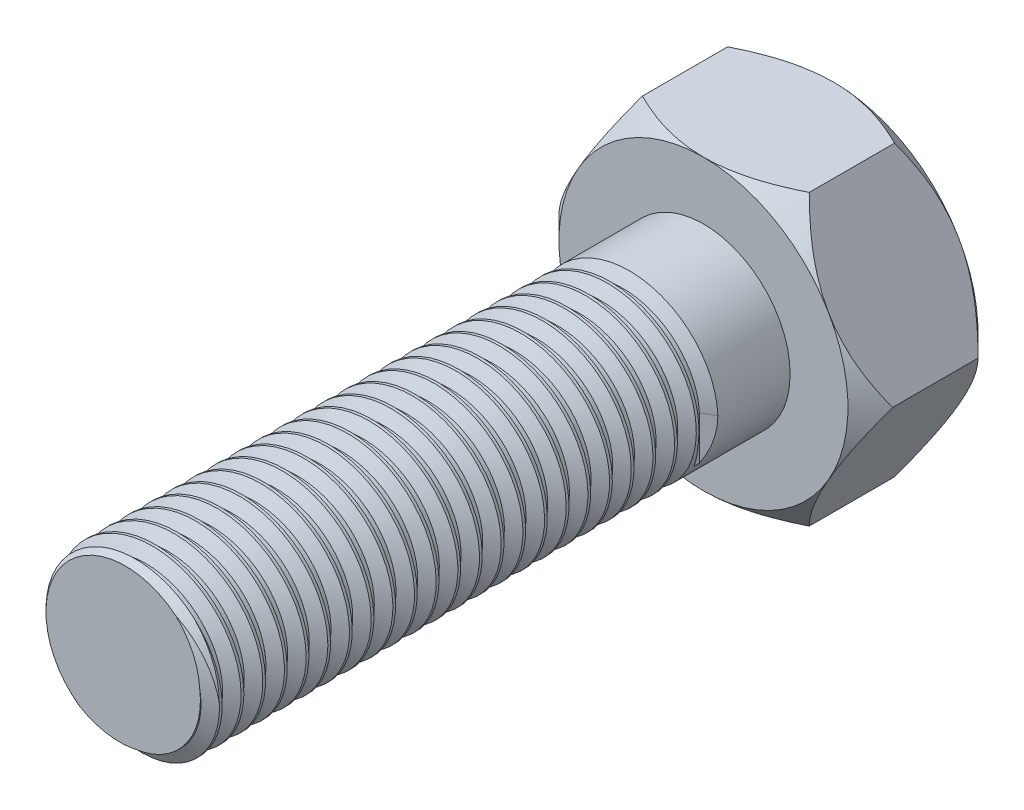
from build123d import *

# Parameters (mm, degrees)
BOSS_EXTRUDE1_DEPTH     = 4.5
SKETCH3_OUTSIDE_W       = 68.922
SKETCH3_OUTSIDE_H       = 65.828
SKETCH3_OUTSIDE_R       = 10
CUT_EXTRUDE1_DEPTH      = 18.729448196
CUT_EXTRUDE1_DRAFT      = -45
MIRROR1_COPY_1_SKETCH_W = 68.922
MIRROR1_COPY_1_SKETCH_H = 65.828
MIRROR1_COPY_1_SKETCH_R = 10
MIRROR1_COPY_1_DEPTH    = 18.729448196
MIRROR1_COPY_1_DRAFT    = -45
SKETCH4_R               = 6
BOSS_EXTRUDE2_DEPTH     = 40
CHAMFER1_SIZE           = 0.5
THREAD1_PITCH           = 1.5
CUT_EXTRUDE2_DEPTH      = 48.048733694


with BuildPart() as part:
    # Sketch1 → Boss-Extrude1 (new, symmetric)
    with BuildSketch(Plane.XY):
        Polygon((5.773502692, -10), (11.547005384, 0), (5.773502692, 10), (-5.773502692, 10), (-11.547005384, 0), (-5.773502692, -10), align=None)
    extrude(amount=BOSS_EXTRUDE1_DEPTH, both=True)


with BuildPart() as cut_extrude1_tool:
    # Sketch3 outside → Cut-Extrude1 (with draft: the straight prism first)
    with BuildSketch(Plane.XY.offset(4.5)):
        Rectangle(SKETCH3_OUTSIDE_W, SKETCH3_OUTSIDE_H)
        Circle(SKETCH3_OUTSIDE_R, mode=Mode.SUBTRACT)
    extrude(amount=-CUT_EXTRUDE1_DEPTH)
    # Cut-Extrude1: the draft: its side faces are tilted about the plane it starts from
    cut_extrude1_sides = [cut_extrude1_tool.faces().sort_by_distance(p)[0] for p in [
        (0, -32.914, -4.864724098),
        (34.461, 0, -4.864724098),
        (0, 32.914, -4.864724098),
        (-34.461, 0, -4.864724098),
        (-10, 0, -4.864724098),
    ]]
    draft(cut_extrude1_sides, Plane.XY.offset(4.5), CUT_EXTRUDE1_DRAFT)


with BuildPart() as part_1:
    add(part.part)

    # Cut-Extrude1: cut by cut_extrude1_tool
    add(cut_extrude1_tool.part, mode=Mode.SUBTRACT)


with BuildPart() as mirror1_copy_1_tool:
    # Mirror1 copy 1 sketch → Mirror1 copy 1 (with draft: the straight prism first)
    with BuildSketch(Plane(origin=(0, 0, -4.5), x_dir=(1, 0, 0), z_dir=(0, 0, -1))):
        Rectangle(MIRROR1_COPY_1_SKETCH_W, MIRROR1_COPY_1_SKETCH_H)
        Circle(MIRROR1_COPY_1_SKETCH_R, mode=Mode.SUBTRACT)
    extrude(amount=-MIRROR1_COPY_1_DEPTH)
    # Mirror1 copy 1: the draft: its side faces are tilted about the plane it starts from
    mirror1_copy_1_sides = [mirror1_copy_1_tool.faces().sort_by_distance(p)[0] for p in [
        (0, -32.914, 4.864724098),
        (34.461, 0, 4.864724098),
        (0, 32.914, 4.864724098),
        (-34.461, 0, 4.864724098),
        (-10, 0, 4.864724098),
    ]]
    draft(mirror1_copy_1_sides, Plane(origin=(0, 0, -4.5), x_dir=(1, 0, 0), z_dir=(0, 0, -1)), MIRROR1_COPY_1_DRAFT)


with BuildPart() as part_2:
    add(part_1.part)

    # Mirror1 copy 1: cut by mirror1_copy_1_tool
    add(mirror1_copy_1_tool.part, mode=Mode.SUBTRACT)

    # Sketch4 → Boss-Extrude2 (add)
    with BuildSketch(Plane.XY.offset(4.5)):
        Circle(SKETCH4_R)
    extrude(amount=BOSS_EXTRUDE2_DEPTH)

    # Chamfer1
    chamfer1_edges = [part_2.edges().sort_by_distance(p)[0] for p in [
        (-6, 0, 44.5),
    ]]
    chamfer(chamfer1_edges, length=CHAMFER1_SIZE)

    # Thread1: arcs per turn and ends read off the stored shape
    # Thread1: the profile of Thread Profile1 profile screwed along a right-hand helix through 23.666667 turns, 8 arcs to a turn; built about Z, then put on its axis
    thread1_z = Axis((0, 0, 0), (0, 0, 1))
    thread1_corners = [(6.0003, 0, -0.000173205), (6.0003, 0, 1.312673201), (5.188101188, 0, 0.843749998), (5.188101188, 0, 0.468749998)]
    with BuildLine(mode=Mode.PRIVATE) as thread1_profile:
        Line(thread1_corners[0], thread1_corners[1])
        Line(thread1_corners[1], thread1_corners[2])
        Line(thread1_corners[2], thread1_corners[3])
        Line(thread1_corners[3], thread1_corners[0])
    thread1_cap = Face(thread1_profile.wire())
    thread1_turn_angles = [0, 22.5, 45, 67.5, 90, 112.5, 135, 157.5, 180, 202.5, 225, 247.5, 270, 292.5, 315, 337.5, 360]
    thread1_turn_weights = [1, 0.9238795325112867, 1, 0.9238795325112867, 1, 0.9238795325112867, 1, 0.9238795325112867, 1, 0.9238795325112867, 1, 0.9238795325112867, 1, 0.9238795325112867, 1, 0.9238795325112867, 1]
    thread1_turn_rails = [Edge.make_bspline([Vector(p[0], p[1], 0).rotate(thread1_z, thread1_turn_angles[k]) / thread1_turn_weights[k] + Vector(0, 0, p[2] + THREAD1_PITCH * thread1_turn_angles[k] / 360) for k in range(17)], [0, 0, 0, 1, 1, 2, 2, 3, 3, 4, 4, 5, 5, 6, 6, 7, 7, 8, 8, 8], 2, thread1_turn_weights) for p in thread1_corners]
    thread1_turn_sides = [Face.make_surface_from_curves(thread1_turn_rails[p[0]], thread1_turn_rails[p[1]]) for p in [(0, 1), (1, 2), (2, 3), (3, 0)]]
    thread1_last_angles = [8280, 8302.5, 8325, 8347.5, 8370, 8392.5, 8415, 8437.5, 8460, 8482.5, 8505, 8512.5, 8520]
    thread1_last_weights = [1, 0.9238795325112867, 1, 0.9238795325112867, 1, 0.9238795325112867, 1, 0.9238795325112867, 1, 0.9238795325112867, 1, 0.9914448613738104, 1]
    thread1_last_rails = [Edge.make_bspline([Vector(p[0], p[1], 0).rotate(thread1_z, thread1_last_angles[k]) / thread1_last_weights[k] + Vector(0, 0, p[2] + THREAD1_PITCH * thread1_last_angles[k] / 360) for k in range(13)], [0, 0, 0, 1, 1, 2, 2, 3, 3, 4, 4, 5, 5, 6, 6, 6], 2, thread1_last_weights) for p in thread1_corners]
    thread1_last_sides = [Face.make_surface_from_curves(thread1_last_rails[p[0]], thread1_last_rails[p[1]]) for p in [(0, 1), (1, 2), (2, 3), (3, 0)]]
    thread1 = Plane(origin=(0, 0, 9.5), x_dir=(1, 0, 0), z_dir=(0, 0, 1)) * Solid(Shell([*[p.moved(Location((0, 0, THREAD1_PITCH * i))) for i in range(23) for p in thread1_turn_sides], *thread1_last_sides, thread1_cap, thread1_cap.rotate(thread1_z, 8520).moved(Location((0, 0, THREAD1_PITCH * 8520 / 360)))]))
    add(thread1, mode=Mode.SUBTRACT)

    # Sketch12 → Cut-Extrude2 (cut, through all)
    with BuildSketch(Plane(origin=(0, 0, 0), x_dir=(1, 0, 0), z_dir=(0, 1, 0))):
        Polygon((6, -9.5), (5.188101188, -9.968749998), (5.188101188, -10.343749998), (6, -10.812499996), align=None)
    extrude(amount=-CUT_EXTRUDE2_DEPTH, mode=Mode.SUBTRACT)


solid = part_2.part
